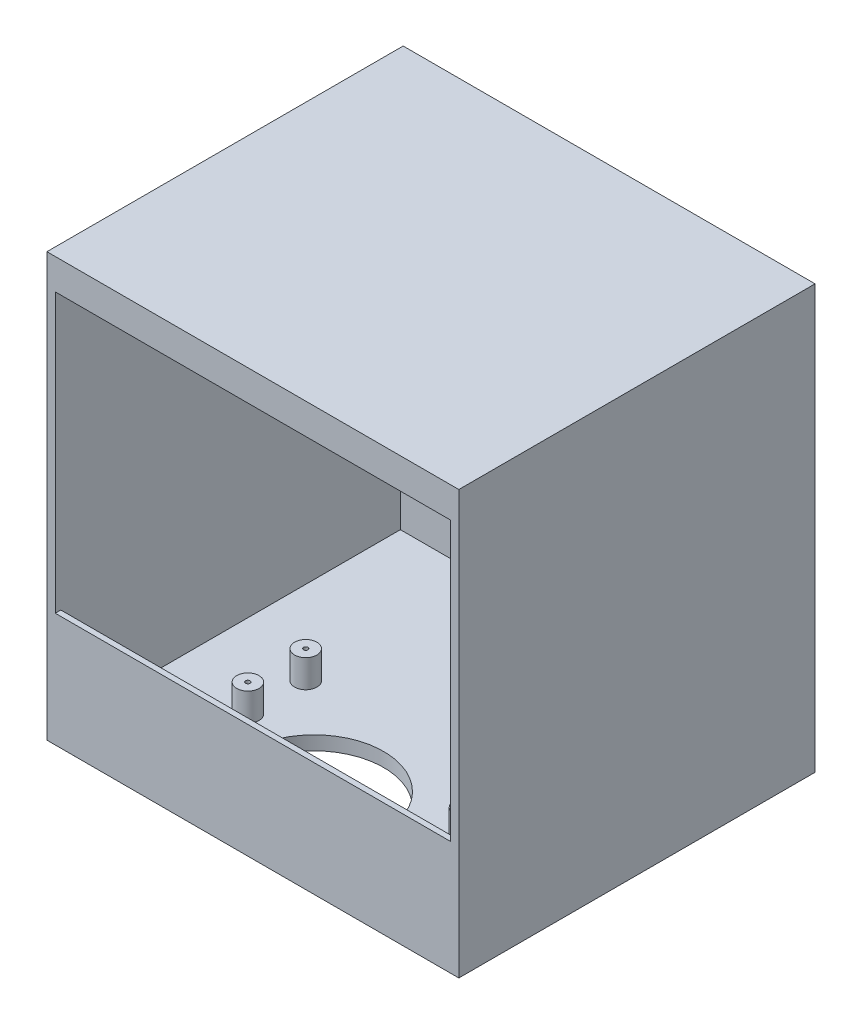
from build123d import *

# Parameters (mm, degrees)
SKETCH1_W                = 469.9
SKETCH1_H                = 482.6
FULL_BOX_DEPTH           = 406.4
SKETCH2_W                = 450.85
SKETCH2_H                = 317.5
INSIDE_CUT_DEPTH         = 393.7
SKETCH3_W                = 450.85
SKETCH3_H                = 387.35
FLOOR_CUT_DEPTH          = 114.3
SKETCH4_R                = 79.375
DRAIN_HOLE_DEPTH         = 778.045169617
SKETCH5_R                = 12.7
PEGS_DEPTH               = 31.75
PEGS_2_DEPTH             = 31.75
PEGS_3_DEPTH             = 31.75
PEGS_4_DEPTH             = 31.75
HOLES_IN_PEGS_AT_2_COUNT = 2
HOLES_IN_PEGS_AT_2_PITCH = 66.04
HOLES_IN_PEGS_AT_3_COUNT = 2
HOLES_IN_PEGS_AT_3_PITCH = 256.304124235
HOLES_IN_PEGS_AT_4_COUNT = 2
HOLES_IN_PEGS_AT_4_PITCH = 247.65


with BuildPart() as part:
    # Sketch1 → full box (new body)
    with BuildSketch(Plane.XY):
        with Locations((234.95, -241.3)):
            Rectangle(SKETCH1_W, SKETCH1_H)
    extrude(amount=-FULL_BOX_DEPTH)

    # Sketch2 → inside cut (cut)
    with BuildSketch(Plane.XY):
        with Locations((234.95, -193.675)):
            Rectangle(SKETCH2_W, SKETCH2_H)
    extrude(amount=-INSIDE_CUT_DEPTH, mode=Mode.SUBTRACT)

    # Sketch3 → floor cut (cut)
    with BuildSketch(Plane(origin=(0, -352.425, 0), x_dir=(1, 0, 0), z_dir=(0, 1, 0))):
        with Locations((234.95, 200.025)):
            Rectangle(SKETCH3_W, SKETCH3_H)
    extrude(amount=-FLOOR_CUT_DEPTH, mode=Mode.SUBTRACT)

    # Sketch4 → drain hole (cut, through all)
    with BuildSketch(Plane(origin=(0, -466.725, 0), x_dir=(1, 0, 0), z_dir=(0, 1, 0))):
        with Locations((219.075, 85.725)):
            Circle(SKETCH4_R)
    extrude(amount=-DRAIN_HOLE_DEPTH, mode=Mode.SUBTRACT)


with BuildPart() as body_2:
    # Sketch5 → pegs (new body)
    with BuildSketch(Plane(origin=(0, -466.725, 0), x_dir=(1, 0, 0), z_dir=(0, 1, 0))):
        with Locations((104.775, 124.46)):
            Circle(SKETCH5_R)
    extrude(amount=PEGS_DEPTH)

    # Sketch19 → holes in pegs (revolve, cut)
    with BuildSketch(Plane(origin=(104.775, -434.975, -124.46), x_dir=(0, 0, 1), z_dir=(1, 0, 0))):
        Polygon((0, 0), (0, 20.583816902), (2.5527, 19.05), (2.5527, 0), align=None)
    holes_in_pegs = revolve(axis=Axis((104.775, -428.625, -124.46), (0, -1, 0)), mode=Mode.SUBTRACT)


with BuildPart() as body_3:
    # Sketch5 → pegs 2 (new body)
    with BuildSketch(Plane(origin=(0, -466.725, 0), x_dir=(1, 0, 0), z_dir=(0, 1, 0))):
        with Locations((352.425, 124.46)):
            Circle(SKETCH5_R)
    extrude(amount=PEGS_2_DEPTH)

    # holes in pegs at 4: holes in pegs ×2
    with Locations(*[(i * HOLES_IN_PEGS_AT_4_PITCH, 0, 0) for i in range(1, HOLES_IN_PEGS_AT_4_COUNT)]):
        add(holes_in_pegs, mode=Mode.SUBTRACT)


with BuildPart() as body_4:
    # Sketch5 → pegs 3 (new body)
    with BuildSketch(Plane(origin=(0, -466.725, 0), x_dir=(1, 0, 0), z_dir=(0, 1, 0))):
        with Locations((352.425, 190.5)):
            Circle(SKETCH5_R)
    extrude(amount=PEGS_3_DEPTH)

    # holes in pegs at 3: holes in pegs ×2
    with Locations(*[Vector(0.9662349396012463, 0, -0.2576626505603324) * (i * HOLES_IN_PEGS_AT_3_PITCH) for i in range(1, HOLES_IN_PEGS_AT_3_COUNT)]):
        add(holes_in_pegs, mode=Mode.SUBTRACT)


with BuildPart() as body_5:
    # Sketch5 → pegs 4 (new body)
    with BuildSketch(Plane(origin=(0, -466.725, 0), x_dir=(1, 0, 0), z_dir=(0, 1, 0))):
        with Locations((104.775, 190.5)):
            Circle(SKETCH5_R)
    extrude(amount=PEGS_4_DEPTH)

    # holes in pegs at 2: holes in pegs ×2
    with Locations(*[(0, 0, -i * HOLES_IN_PEGS_AT_2_PITCH) for i in range(1, HOLES_IN_PEGS_AT_2_COUNT)]):
        add(holes_in_pegs, mode=Mode.SUBTRACT)


solid = Compound([part.part, body_2.part, body_3.part, body_4.part, body_5.part])
